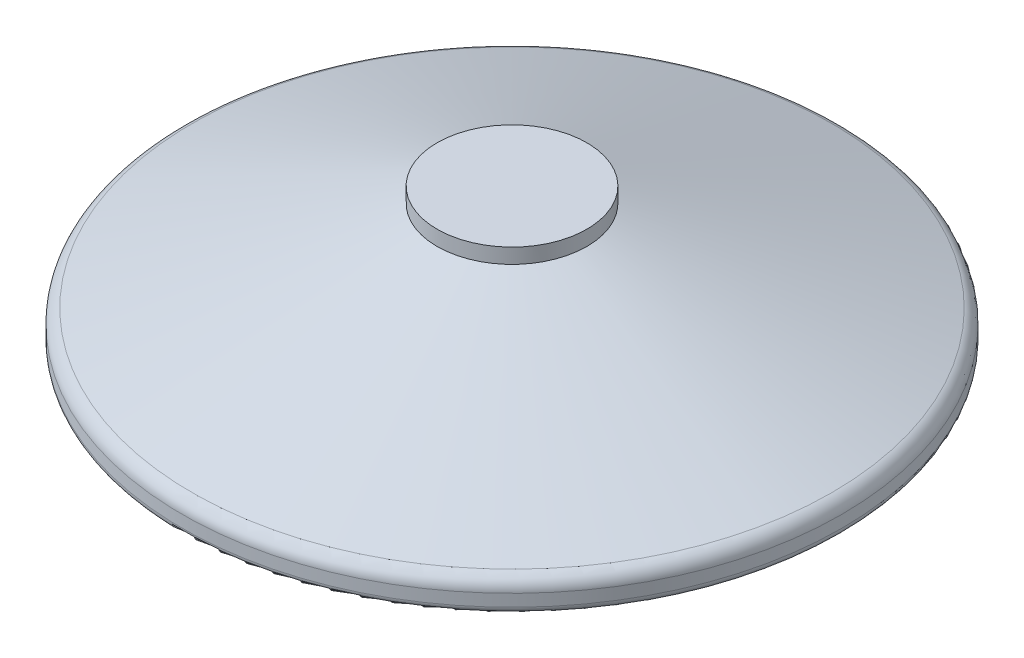
from build123d import *

# Parameters (mm, degrees)
FILLET1_R = 1
FILLET2_R = 0.5


with BuildPart() as part:
    # Sketch1 → Revolve1 (revolve)
    with BuildSketch(Plane.XY):
        Polygon((-6, 4.153212483), (-21.5, 0), (-22, 0), (-22, 2), (-5, 8.3), (-5, 9.3), (0, 9.3), (0, 4.153212483), align=None)
    revolve(axis=Axis((0, 57.053571429, 0), (0, -1, 0)))

    # Fillet1
    fillet1_edges = [part.edges().sort_by_distance(p)[0] for p in [
        (22, 2, 0),
    ]]
    fillet(fillet1_edges, radius=FILLET1_R)

    # Fillet2
    fillet2_edges = [part.edges().sort_by_distance(p)[0] for p in [
        (22, 0, 0),
    ]]
    fillet(fillet2_edges, radius=FILLET2_R - 0.0001)  # a hair under: the kernel refuses the full size


solid = part.part
